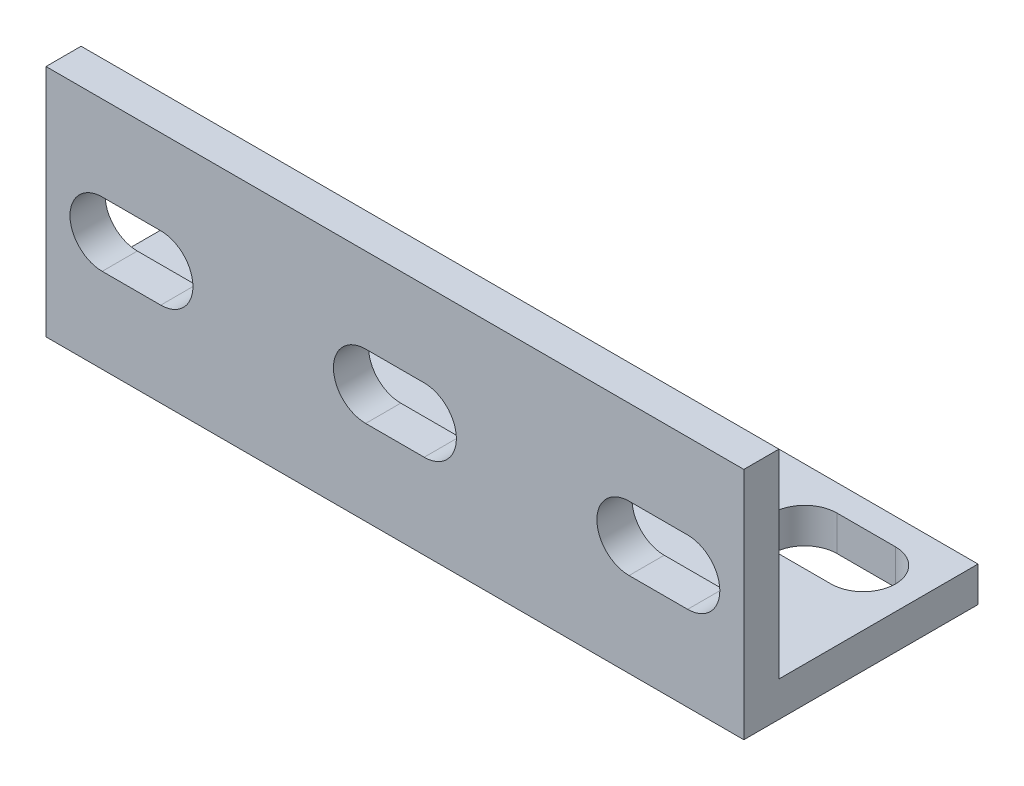
from build123d import *

# Parameters (mm, degrees)
BOSS_EXTRUDE1_DEPTH  = 59.6
CUT_EXTRUDE1_DEPTH   = 66.124189054
LPATTERN1_COUNT      = 2
LPATTERN1_PITCH      = 22.5
LPATTERN1_COUNT_DIR2 = 2
LPATTERN1_PITCH_DIR2 = 22.5
CUT_EXTRUDE2_DEPTH   = 66.124189054
LPATTERN2_COUNT      = 2
LPATTERN2_PITCH      = 22.5
LPATTERN2_COUNT_DIR2 = 2
LPATTERN2_PITCH_DIR2 = 22.5


with BuildPart() as part:
    # Sketch1 → Boss-Extrude1 (new body)
    with BuildSketch(Plane(origin=(0, 0, 0), x_dir=(0, 0, -1), z_dir=(1, 0, 0))):
        Polygon((0, 20), (0, 0), (20, 0), (20, 3), (3, 3), (3, 20), align=None)
    extrude(amount=-BOSS_EXTRUDE1_DEPTH)

    # Sketch2 → Cut-Extrude1 (cut, through all)
    with BuildSketch(Plane(origin=(0, 0, -3), x_dir=(-1, 0, 0), z_dir=(0, 0, -1))):
        with BuildLine():
            Line((27.3, 12.75), (32.3, 12.75))
            ThreePointArc((32.3, 12.75), (35.05, 10), (32.3, 7.25))
            Line((32.3, 7.25), (27.3, 7.25))
            ThreePointArc((27.3, 7.25), (24.55, 10), (27.3, 12.75))
        make_face()
    cut_extrude1 = extrude(amount=-CUT_EXTRUDE1_DEPTH, mode=Mode.SUBTRACT)

    # LPattern1: Cut-Extrude1 2 × 2
    with Locations(*[Vector(-1, 0, 0) * (i * LPATTERN1_PITCH) + Vector(1, 0, 0) * (j * LPATTERN1_PITCH_DIR2) for i in range(LPATTERN1_COUNT) for j in range(LPATTERN1_COUNT_DIR2) if (i, j) != (0, 0)]):
        add(cut_extrude1, mode=Mode.SUBTRACT)

    # Sketch3 → Cut-Extrude2 (cut, through all)
    with BuildSketch(Plane(origin=(0, 3, 0), x_dir=(1, 0, 0), z_dir=(0, 1, 0))):
        with BuildLine():
            Line((-27.3, 12.25), (-32.3, 12.25))
            ThreePointArc((-32.3, 12.25), (-35.05, 15), (-32.3, 17.75))
            Line((-32.3, 17.75), (-27.3, 17.75))
            ThreePointArc((-27.3, 17.75), (-24.55, 15), (-27.3, 12.25))
        make_face()
    cut_extrude2 = extrude(amount=-CUT_EXTRUDE2_DEPTH, mode=Mode.SUBTRACT)

    # LPattern2: Cut-Extrude2 2 × 2
    with Locations(*[Vector(-1, 0, 0) * (i * LPATTERN2_PITCH) + Vector(1, 0, 0) * (j * LPATTERN2_PITCH_DIR2) for i in range(LPATTERN2_COUNT) for j in range(LPATTERN2_COUNT_DIR2) if (i, j) != (0, 0)]):
        add(cut_extrude2, mode=Mode.SUBTRACT)


solid = part.part
